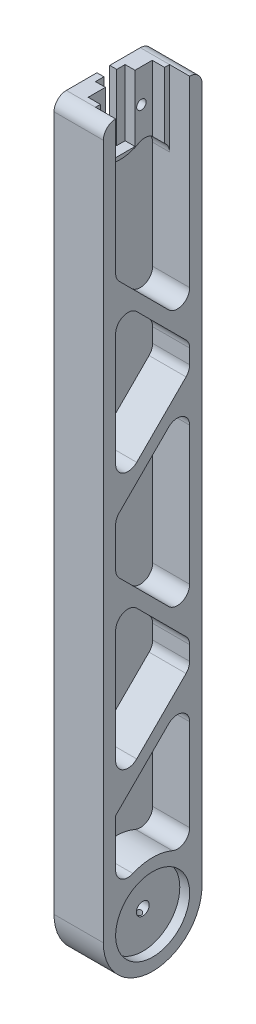
from build123d import *

# Parameters (mm, degrees)
SKETCH1_R                 = 12.7
BOSS_EXTRUDE1_DEPTH       = 12.7
BOSS_EXTRUDE2_DEPTH       = 17
CUT_EXTRUDE3_DEPTH        = 17
BOSS_EXTRUDE4_REACH       = 36.708
F_2_CLEARANCE_HOLE1_D     = 2.4384
F_2_CLEARANCE_HOLE1_DEPTH = 25.4
F_2_CLEARANCE_HOLE1_TIP   = 0.732569267
SKETCH14_W                = 52.115370156
SKETCH14_H                = 48.846284602
CUT_EXTRUDE4_DEPTH        = 12.7
SKETCH15_W                = 12.7
SKETCH15_H                = 25.4
BOSS_EXTRUDE5_DEPTH       = 177.8
SKETCH16_W                = 12.7
SKETCH16_H                = 3.175
BOSS_EXTRUDE6_DEPTH       = 17
FILLET1_R                 = 3.175
FILLET2_R                 = 12.7
SKETCH17_R                = 1.651
CUT_EXTRUDE5_DEPTH        = 9.525
SKETCH18_R                = 9.525
CUT_EXTRUDE6_DEPTH        = 2.54
CUT_EXTRUDE7_START        = -9.525
CUT_EXTRUDE7_DEPTH        = 9.525
SKETCH23_W                = 12.972727012
SKETCH23_H                = 10.013690803
CUT_EXTRUDE8_DEPTH        = 8.362229451
FILLET3_R                 = 3.175


# Read off the part's stored shape, not the designer's step: Cut-Extrude7
# Some blends are built 0.0001 mm under size
with BuildPart() as part:
    # Sketch1 → Boss-Extrude1 (new body)
    with BuildSketch(Plane(origin=(0, 0, 0), x_dir=(1, 0, 0), z_dir=(0, 1, 0))):
        with Locations(Location((0, 0, 0), (0, 0, 270))):
            Circle(SKETCH1_R)
    extrude(amount=BOSS_EXTRUDE1_DEPTH)

    # Sketch7 → Boss-Extrude2 (add)
    with BuildSketch(Plane(origin=(0, 12.7, 0), x_dir=(1, 0, 0), z_dir=(0, 1, 0))):
        with BuildLine():
            ThreePointArc((-8.400260413, 9.525), (-11.575260413, 5.225260413), (-12.7, 0))
            ThreePointArc((-12.7, 0), (-11.575260413, -5.225260413), (-8.400260413, -9.525))
            Line((-8.400260413, -9.525), (-5.08, -9.525))
            Line((-5.08, -9.525), (-5.08, -8.255))
            Line((-5.08, -8.255), (-8.254457173, -8.255))
            Line((-8.254457173, -8.255), (-8.254457173, 8.255))
            Line((-8.254457173, 8.255), (-5.08, 8.255))
            Line((-5.08, 8.255), (-5.08, 9.525))
            Line((-5.08, 9.525), (-8.400260413, 9.525))
        make_face()
    extrude(amount=BOSS_EXTRUDE2_DEPTH)

    # Sketch8 → Cut-Extrude3 (cut)
    with BuildSketch(Plane(origin=(0, 29.7, 0), x_dir=(1, 0, 0), z_dir=(0, 1, 0))):
        Polygon((-8.254457173, -3.81), (-8.254457173, 3.81), (-10.794457173, 3.81), (-10.794457173, 1.651), (-12.7, 1.651), (-12.7, -1.651), (-10.794457173, -1.651), (-10.794457173, -3.81), align=None)
    extrude(amount=-CUT_EXTRUDE3_DEPTH, mode=Mode.SUBTRACT)

    # Boss-Extrude4: up to this face of the body (flat: up to its plane)
    boss_extrude4_end = Plane(part.part.faces().sort_by_distance((0, 0, 0))[0])
    # Sketch13 → Boss-Extrude4 (add, up to the picked face)
    with BuildSketch(Plane(origin=(0, 29.7, 0), x_dir=(1, 0, 0), z_dir=(0, 1, 0)), mode=Mode.PRIVATE) as boss_extrude4_sk1:
        with BuildLine():
            Line((-12.592227722, 1.651), (-12.592227722, 9.525))
            Line((-12.592227722, 9.525), (-8.400260413, 9.525))
            ThreePointArc((-8.400260413, 9.525), (-11.210312597, 5.968156456), (-12.592227722, 1.651))
        make_face()
    boss_extrude4_tool1 = split(extrude(boss_extrude4_sk1.sketch, amount=-BOSS_EXTRUDE4_REACH, mode=Mode.PRIVATE), bisect_by=boss_extrude4_end, keep=Keep.BOTH, mode=Mode.PRIVATE)
    # Sketch13 → Boss-Extrude4 (add, up to the picked face)
    with BuildSketch(Plane(origin=(0, 29.7, 0), x_dir=(1, 0, 0), z_dir=(0, 1, 0)), mode=Mode.PRIVATE) as boss_extrude4_sk2:
        with BuildLine():
            Line((-12.592227722, -1.651), (-12.592227722, -9.525))
            Line((-12.592227722, -9.525), (-8.400260413, -9.525))
            ThreePointArc((-8.400260413, -9.525), (-11.210312597, -5.968156456), (-12.592227722, -1.651))
        make_face()
    boss_extrude4_tool2 = split(extrude(boss_extrude4_sk2.sketch, amount=-BOSS_EXTRUDE4_REACH, mode=Mode.PRIVATE), bisect_by=boss_extrude4_end, keep=Keep.BOTH, mode=Mode.PRIVATE)
    add(boss_extrude4_tool1.solids().sort_by(Axis((-11.366083, 29.7, -7.381946), (0, -1, 0)))[0])
    add(boss_extrude4_tool2.solids().sort_by(Axis((-11.366083, 29.7, 7.381946), (0, -1, 0)))[0])

    # #2 Clearance Hole1
    with Locations(Plane(origin=(-8.254457173, 0, 0), x_dir=(0, 0, -1), z_dir=(1, 0, 0))):
        with Locations((-5.46, 21.2), (5.46, 21.2)):
            Hole(F_2_CLEARANCE_HOLE1_D / 2, depth=F_2_CLEARANCE_HOLE1_DEPTH)
            with Locations((0, 0, -(F_2_CLEARANCE_HOLE1_DEPTH + F_2_CLEARANCE_HOLE1_TIP / 2))):  # 118° drill point
                Cone(0, F_2_CLEARANCE_HOLE1_D / 2, F_2_CLEARANCE_HOLE1_TIP, mode=Mode.SUBTRACT)

    # Sketch14 → Cut-Extrude4 (cut)
    with BuildSketch(Plane(origin=(0, 12.7, 0), x_dir=(1, 0, 0), z_dir=(0, 1, 0))):
        Rectangle(SKETCH14_W, SKETCH14_H)
    extrude(amount=-CUT_EXTRUDE4_DEPTH, mode=Mode.SUBTRACT)


with BuildPart() as cut_extrude4_piece_1:
    # of the separate pieces the step leaves, piece 1, a body of its own (cut_extrude4_pieces)
    add(part.part.solids().sort_by_distance((-5.08, 29.7, 9.525))[0])



with BuildPart() as cut_extrude4_piece_2:
    # of the separate pieces the step leaves, piece 2, a body of its own (cut_extrude4_pieces)
    add(part.part.solids().sort_by_distance((-12.592227722, 29.7, -9.525))[0])


with BuildPart() as cut_extrude4_piece_1_1:
    add(cut_extrude4_piece_1.part)

    add(cut_extrude4_piece_2.part)  # Boss-Extrude5 merges Cut-Extrude4 piece 2
    # Sketch15 → Boss-Extrude5 (add)
    with BuildSketch(Plane.XZ.offset(-12.7)):
        with Locations((-6.242227722, 0)):
            Rectangle(SKETCH15_W, SKETCH15_H)
    extrude(amount=BOSS_EXTRUDE5_DEPTH)

    # Sketch16 → Boss-Extrude6 (add)
    with BuildSketch(Plane(origin=(0, 12.7, 0), x_dir=(1, 0, 0), z_dir=(0, 1, 0))):
        with Locations((-6.242227722, 11.1125)):
            Rectangle(SKETCH16_W, SKETCH16_H)
        with Locations((-6.242227722, -11.1125)):
            Rectangle(SKETCH16_W, SKETCH16_H)
    extrude(amount=BOSS_EXTRUDE6_DEPTH)

    # Fillet1
    fillet1_edges = [cut_extrude4_piece_1_1.edges().sort_by_distance(p)[0] for p in [
        (-6.242227722, 29.7, 12.7),
        (-6.242227722, 29.7, -12.7),
    ]]
    fillet(fillet1_edges, radius=FILLET1_R - 0.0001)  # a hair under: the kernel refuses the full size

    # Fillet2
    fillet2_edges = [cut_extrude4_piece_1_1.edges().sort_by_distance(p)[0] for p in [
        (-6.242227722, -165.1, 12.7),
        (-6.242227722, -165.1, -12.7),
    ]]
    fillet(fillet2_edges, radius=FILLET2_R - 0.0001)  # a hair under: the kernel refuses the full size

    # Sketch17 → Cut-Extrude5 (cut)
    with BuildSketch(Plane(origin=(0.107772278, 0, 0), x_dir=(0, 0, -1), z_dir=(1, 0, 0))):
        with Locations((0, -152.4)):
            Circle(SKETCH17_R)
    extrude(amount=-CUT_EXTRUDE5_DEPTH, mode=Mode.SUBTRACT)

    # Sketch18 → Cut-Extrude6 (cut)
    with BuildSketch(Plane(origin=(0.107772278, 0, 0), x_dir=(0, 0, -1), z_dir=(1, 0, 0))):
        with Locations((0, -152.4)):
            Circle(SKETCH18_R)
    extrude(amount=-CUT_EXTRUDE6_DEPTH, mode=Mode.SUBTRACT)

    # Sketch19 → #2-56 Tapped Hole1 (revolve, cut)
    with BuildSketch(Plane(origin=(-3.702227722, -152.4, 0), x_dir=(0, 0, 1), z_dir=(1, 0, 0))):
        Polygon((0, 0), (0, 13.74216509), (0.889, 13.208), (0.889, 0), align=None)
    revolve(axis=Axis((-3.702227722, -146.05, 0), (0, -1, 0)), mode=Mode.SUBTRACT)

    # Cut-Extrude7 outline → Cut-Extrude7 (cut)
    with BuildSketch(Plane(origin=(0.107772278, 0, 0), x_dir=(0, 0, -1), z_dir=(1, 0, 0)).offset(CUT_EXTRUDE7_START)):
        with BuildLine():
            Line((-9.525, -6.059343702), (9.525, -25.109343702))
            Line((9.525, -25.109343702), (9.525, 21.2))
            ThreePointArc((9.525, 21.2), (0, 11.675), (-9.525, 21.2))
            Line((-9.525, 21.2), (-9.525, -6.059343702))
        make_face()
        Polygon((-9.525, -54.999471762), (9.525, -35.949471762), (9.525, -29.599471762), (-9.525, -10.549471762), align=None)
        Polygon((-9.525, -72.189599823), (9.525, -91.239599823), (9.525, -40.439599823), (-9.525, -59.489599823), align=None)
        Polygon((-9.525, -121.129727883), (9.525, -102.079727883), (9.525, -95.729727883), (-9.525, -76.679727883), align=None)
        with BuildLine():
            ThreePointArc((-9.525, -143.999739587), (0, -139.7), (9.525, -143.999739587))
            Line((9.525, -143.999739587), (9.525, -106.569855944))
            Line((9.525, -106.569855944), (-9.525, -125.619855944))
            Line((-9.525, -125.619855944), (-9.525, -143.999739587))
        make_face()
    extrude(amount=CUT_EXTRUDE7_DEPTH, mode=Mode.SUBTRACT)

    # Sketch23 → Cut-Extrude8 (cut)
    with BuildSketch(Plane(origin=(-8.254457173, 0, 0), x_dir=(0, 0, -1), z_dir=(1, 0, 0))):
        with Locations((0.296508778, 11.530489285)):
            Rectangle(SKETCH23_W, SKETCH23_H)
    extrude(amount=CUT_EXTRUDE8_DEPTH, mode=Mode.SUBTRACT)

    # Fillet3
    # the kernel refuses this fillet: 3.175 mm, written as the material it adds along each edge
    with BuildSketch(Plane(origin=(-12.705047873, -6.059343702, 9.525), x_dir=(0, -0.7071067811865476, -0.7071067811865476), z_dir=(1, 0, 0))) as fillet3_piece_1_section:
        with BuildLine():
            CenterArc((FILLET3_R * 0.414213562373, FILLET3_R), FILLET3_R, 225, 45)
            Line((-FILLET3_R * 0.292893218813, FILLET3_R * 0.292893218813), (0, 0))
            Line((0, 0), (FILLET3_R * 0.414213562373, 0))
        make_face()
    fillet3_piece_1 = extrude(amount=12.812820151, mode=Mode.PRIVATE)
    fillet3_piece_1 = split(fillet3_piece_1, bisect_by=Plane(origin=(-12.592227722, -5.980218736, 9.333975434), z_dir=(1, 0, 0)), keep=Keep.TOP, mode=Mode.PRIVATE)
    add(fillet3_piece_1)
    with BuildSketch(Plane(origin=(-28.580047873, -25.109343702, -9.525), x_dir=(0, 1, 0), z_dir=(1, 0, 0))) as fillet3_piece_2_section:
        with BuildLine():
            CenterArc((FILLET3_R * 2.41421356237, FILLET3_R), FILLET3_R, 135, 135)
            Line((FILLET3_R * 1.70710678119, FILLET3_R * 1.70710678119), (0, 0))
            Line((0, 0), (FILLET3_R * 2.41421356237, 0))
        make_face()
    fillet3_piece_2 = extrude(amount=28.687820151, mode=Mode.PRIVATE)
    fillet3_piece_2 = split(fillet3_piece_2, bisect_by=Plane(origin=(-12.592227722, -21.703583978, -8.114288132), z_dir=(1, 0, 0)), keep=Keep.TOP, mode=Mode.PRIVATE)
    add(fillet3_piece_2)
    with BuildSketch(Plane(origin=(-36.913534292, 21.2, -9.525), x_dir=(0, -0.8660254037844385, 0.5000000000000003), z_dir=(1, 0, 0))) as fillet3_piece_3_section:
        with BuildLine():
            CenterArc((11.1125, 2.749630657), FILLET3_R, 120, 120)
            Line((9.525, 5.499261314), (0, 0))
            ThreePointArc((0, 0), (4.7625, 1.276108029), (9.525, 0))
        make_face()
    fillet3_piece_3 = extrude(amount=59.329840862, mode=Mode.PRIVATE)
    fillet3_piece_3 = split(fillet3_piece_3, bisect_by=Plane(origin=(-8.254457173, 14.198741561, -7.389428404), z_dir=(-1, 0, 0)), keep=Keep.TOP, mode=Mode.PRIVATE)
    fillet3_piece_3 = split(fillet3_piece_3, bisect_by=Plane(origin=(-12.592227722, 14.198741561, -7.389428404), z_dir=(1, 0, 0)), keep=Keep.TOP, mode=Mode.PRIVATE)
    add(fillet3_piece_3)
    with BuildSketch(Plane(origin=(-36.913534292, 21.2, -9.525), x_dir=(0, -0.8660254037844385, 0.5000000000000003), z_dir=(1, 0, 0))) as fillet3_piece_4_section:
        with BuildLine():
            CenterArc((11.1125, 2.749630657), FILLET3_R, 120, 120)
            Line((9.525, 5.499261314), (0, 0))
            ThreePointArc((0, 0), (4.7625, 1.276108029), (9.525, 0))
        make_face()
    fillet3_piece_4 = extrude(amount=31.833534292, mode=Mode.PRIVATE)
    fillet3_piece_4 = split(fillet3_piece_4, bisect_by=Plane(origin=(-6.667228586, 15.056349516, -8.255), z_dir=(0, 0, -1)), keep=Keep.TOP, mode=Mode.PRIVATE)
    fillet3_piece_4 = split(fillet3_piece_4, bisect_by=Plane(origin=(-12.592227722, 15.056349516, -8.990866495), z_dir=(1, 0, 0)), keep=Keep.TOP, mode=Mode.PRIVATE)
    add(fillet3_piece_4)
    with BuildSketch(Plane(origin=(-36.913534292, 21.2, 9.525), x_dir=(0, -0.8660254037844385, -0.5000000000000003), z_dir=(1, 0, 0))) as fillet3_piece_5_section:
        with BuildLine():
            CenterArc((11.1125, -2.749630657), FILLET3_R, 120, 120)
            Line((9.525, -5.499261314), (0, 0))
            ThreePointArc((0, 0), (4.7625, -1.276108029), (9.525, 0))
        make_face()
    fillet3_piece_5 = extrude(amount=59.329840862, mode=Mode.PRIVATE)
    fillet3_piece_5 = split(fillet3_piece_5, bisect_by=Plane(origin=(-8.254457173, 14.198741561, 7.389428404), z_dir=(-1, 0, 0)), keep=Keep.TOP, mode=Mode.PRIVATE)
    fillet3_piece_5 = split(fillet3_piece_5, bisect_by=Plane(origin=(-12.592227722, 14.198741561, 7.389428404), z_dir=(1, 0, 0)), keep=Keep.TOP, mode=Mode.PRIVATE)
    add(fillet3_piece_5)
    with BuildSketch(Plane(origin=(-36.913534292, 21.2, 9.525), x_dir=(0, -0.8660254037844385, -0.5000000000000003), z_dir=(1, 0, 0))) as fillet3_piece_6_section:
        with BuildLine():
            CenterArc((11.1125, -2.749630657), FILLET3_R, 120, 120)
            Line((9.525, -5.499261314), (0, 0))
            ThreePointArc((0, 0), (4.7625, -1.276108029), (9.525, 0))
        make_face()
    fillet3_piece_6 = extrude(amount=31.833534292, mode=Mode.PRIVATE)
    fillet3_piece_6 = split(fillet3_piece_6, bisect_by=Plane(origin=(-6.667228586, 15.056349516, 8.255), z_dir=(0, 0, 1)), keep=Keep.TOP, mode=Mode.PRIVATE)
    fillet3_piece_6 = split(fillet3_piece_6, bisect_by=Plane(origin=(-12.592227722, 15.056349516, 8.990866495), z_dir=(1, 0, 0)), keep=Keep.TOP, mode=Mode.PRIVATE)
    add(fillet3_piece_6)
    with BuildSketch(Plane(origin=(-28.580047873, -10.549471762, 9.525), x_dir=(0, -0.7071067811865476, -0.7071067811865475), z_dir=(1, 0, 0))) as fillet3_piece_7_section:
        with BuildLine():
            CenterArc((FILLET3_R * 2.41421356237, -FILLET3_R), FILLET3_R, 90, 135)
            Line((FILLET3_R * 1.70710678119, -FILLET3_R * 1.70710678119), (0, 0))
            Line((0, 0), (FILLET3_R * 2.41421356237, 0))
        make_face()
    fillet3_piece_7 = extrude(amount=28.687820151, mode=Mode.PRIVATE)
    fillet3_piece_7 = split(fillet3_piece_7, bisect_by=Plane(origin=(-12.592227722, -13.955231486, 8.114288132), z_dir=(1, 0, 0)), keep=Keep.TOP, mode=Mode.PRIVATE)
    add(fillet3_piece_7)
    with BuildSketch(Plane(origin=(-28.580047873, -54.999471762, 9.525), x_dir=(0, 0.7071067811865476, -0.7071067811865475), z_dir=(1, 0, 0))) as fillet3_piece_8_section:
        with BuildLine():
            CenterArc((FILLET3_R * 2.41421356237, FILLET3_R), FILLET3_R, 135, 135)
            Line((FILLET3_R * 1.70710678119, FILLET3_R * 1.70710678119), (0, 0))
            Line((0, 0), (FILLET3_R * 2.41421356237, 0))
        make_face()
    fillet3_piece_8 = extrude(amount=28.687820151, mode=Mode.PRIVATE)
    fillet3_piece_8 = split(fillet3_piece_8, bisect_by=Plane(origin=(-12.592227722, -51.593712038, 8.114288132), z_dir=(1, 0, 0)), keep=Keep.TOP, mode=Mode.PRIVATE)
    add(fillet3_piece_8)
    with BuildSketch(Plane(origin=(-12.705047873, -35.949471762, -9.525), x_dir=(0, 1, 0), z_dir=(1, 0, 0))) as fillet3_piece_9_section:
        with BuildLine():
            CenterArc((FILLET3_R * 0.414213562373, FILLET3_R), FILLET3_R, 225, 45)
            Line((-FILLET3_R * 0.292893218813, FILLET3_R * 0.292893218813), (0, 0))
            Line((0, 0), (FILLET3_R * 0.414213562373, 0))
        make_face()
    fillet3_piece_9 = extrude(amount=12.812820151, mode=Mode.PRIVATE)
    fillet3_piece_9 = split(fillet3_piece_9, bisect_by=Plane(origin=(-12.592227722, -35.870346796, -9.333975434), z_dir=(1, 0, 0)), keep=Keep.TOP, mode=Mode.PRIVATE)
    add(fillet3_piece_9)
    with BuildSketch(Plane(origin=(-12.705047873, -29.599471762, -9.525), x_dir=(0, 0.7071067811865481, 0.7071067811865468), z_dir=(1, 0, 0))) as fillet3_piece_10_section:
        with BuildLine():
            CenterArc((FILLET3_R * 0.414213562373, FILLET3_R), FILLET3_R, 225, 45)
            Line((-FILLET3_R * 0.292893218813, FILLET3_R * 0.292893218813), (0, 0))
            Line((0, 0), (FILLET3_R * 0.414213562373, 0))
        make_face()
    fillet3_piece_10 = extrude(amount=12.812820151, mode=Mode.PRIVATE)
    fillet3_piece_10 = split(fillet3_piece_10, bisect_by=Plane(origin=(-12.592227722, -29.678596728, -9.333975434), z_dir=(1, 0, 0)), keep=Keep.TOP, mode=Mode.PRIVATE)
    add(fillet3_piece_10)
    with BuildSketch(Plane(origin=(-12.705047873, -72.189599823, 9.525), x_dir=(0, -0.7071067811865476, -0.7071067811865476), z_dir=(1, 0, 0))) as fillet3_piece_11_section:
        with BuildLine():
            CenterArc((FILLET3_R * 0.414213562373, FILLET3_R), FILLET3_R, 225, 45)
            Line((-FILLET3_R * 0.292893218813, FILLET3_R * 0.292893218813), (0, 0))
            Line((0, 0), (FILLET3_R * 0.414213562373, 0))
        make_face()
    fillet3_piece_11 = extrude(amount=12.812820151, mode=Mode.PRIVATE)
    fillet3_piece_11 = split(fillet3_piece_11, bisect_by=Plane(origin=(-12.592227722, -72.110474857, 9.333975434), z_dir=(1, 0, 0)), keep=Keep.TOP, mode=Mode.PRIVATE)
    add(fillet3_piece_11)
    with BuildSketch(Plane(origin=(-28.580047873, -91.239599823, -9.525), x_dir=(0, 1, 0), z_dir=(1, 0, 0))) as fillet3_piece_12_section:
        with BuildLine():
            CenterArc((FILLET3_R * 2.41421356237, FILLET3_R), FILLET3_R, 135, 135)
            Line((FILLET3_R * 1.70710678119, FILLET3_R * 1.70710678119), (0, 0))
            Line((0, 0), (FILLET3_R * 2.41421356237, 0))
        make_face()
    fillet3_piece_12 = extrude(amount=28.687820151, mode=Mode.PRIVATE)
    fillet3_piece_12 = split(fillet3_piece_12, bisect_by=Plane(origin=(-12.592227722, -87.833840099, -8.114288132), z_dir=(1, 0, 0)), keep=Keep.TOP, mode=Mode.PRIVATE)
    add(fillet3_piece_12)
    with BuildSketch(Plane(origin=(-28.580047873, -40.439599823, -9.525), x_dir=(0, -0.7071067811865476, 0.7071067811865475), z_dir=(1, 0, 0))) as fillet3_piece_13_section:
        with BuildLine():
            CenterArc((FILLET3_R * 2.41421356237, FILLET3_R), FILLET3_R, 135, 135)
            Line((FILLET3_R * 1.70710678119, FILLET3_R * 1.70710678119), (0, 0))
            Line((0, 0), (FILLET3_R * 2.41421356237, 0))
        make_face()
    fillet3_piece_13 = extrude(amount=28.687820151, mode=Mode.PRIVATE)
    fillet3_piece_13 = split(fillet3_piece_13, bisect_by=Plane(origin=(-12.592227722, -43.845359547, -8.114288132), z_dir=(1, 0, 0)), keep=Keep.TOP, mode=Mode.PRIVATE)
    add(fillet3_piece_13)
    with BuildSketch(Plane(origin=(-12.705047873, -59.489599823, 9.525), x_dir=(0, 0.7071067811865468, -0.7071067811865481), z_dir=(1, 0, 0))) as fillet3_piece_14_section:
        with BuildLine():
            CenterArc((FILLET3_R * 0.414213562373, -FILLET3_R), FILLET3_R, 90, 45)
            Line((-FILLET3_R * 0.292893218813, -FILLET3_R * 0.292893218813), (0, 0))
            Line((0, 0), (FILLET3_R * 0.414213562373, 0))
        make_face()
    fillet3_piece_14 = extrude(amount=12.812820151, mode=Mode.PRIVATE)
    fillet3_piece_14 = split(fillet3_piece_14, bisect_by=Plane(origin=(-12.592227722, -59.568724789, 9.333975434), z_dir=(1, 0, 0)), keep=Keep.TOP, mode=Mode.PRIVATE)
    add(fillet3_piece_14)
    with BuildSketch(Plane(origin=(-28.580047873, -76.679727883, 9.525), x_dir=(0, -0.7071067811865475, -0.7071067811865476), z_dir=(1, 0, 0))) as fillet3_piece_15_section:
        with BuildLine():
            CenterArc((FILLET3_R * 2.41421356237, -FILLET3_R), FILLET3_R, 90, 135)
            Line((FILLET3_R * 1.70710678119, -FILLET3_R * 1.70710678119), (0, 0))
            Line((0, 0), (FILLET3_R * 2.41421356237, 0))
        make_face()
    fillet3_piece_15 = extrude(amount=28.687820151, mode=Mode.PRIVATE)
    fillet3_piece_15 = split(fillet3_piece_15, bisect_by=Plane(origin=(-12.592227722, -80.085487607, 8.114288132), z_dir=(1, 0, 0)), keep=Keep.TOP, mode=Mode.PRIVATE)
    add(fillet3_piece_15)
    with BuildSketch(Plane(origin=(-28.580047873, -121.129727883, 9.525), x_dir=(0, 0.7071067811865472, -0.7071067811865479), z_dir=(1, 0, 0))) as fillet3_piece_16_section:
        with BuildLine():
            CenterArc((FILLET3_R * 2.41421356237, FILLET3_R), FILLET3_R, 135, 135)
            Line((FILLET3_R * 1.70710678119, FILLET3_R * 1.70710678119), (0, 0))
            Line((0, 0), (FILLET3_R * 2.41421356237, 0))
        make_face()
    fillet3_piece_16 = extrude(amount=28.687820151, mode=Mode.PRIVATE)
    fillet3_piece_16 = split(fillet3_piece_16, bisect_by=Plane(origin=(-12.592227722, -117.723968159, 8.114288132), z_dir=(1, 0, 0)), keep=Keep.TOP, mode=Mode.PRIVATE)
    add(fillet3_piece_16)
    with BuildSketch(Plane(origin=(-12.705047873, -102.079727883, -9.525), x_dir=(0, 1, 0), z_dir=(1, 0, 0))) as fillet3_piece_17_section:
        with BuildLine():
            CenterArc((FILLET3_R * 0.414213562373, FILLET3_R), FILLET3_R, 225, 45)
            Line((-FILLET3_R * 0.292893218813, FILLET3_R * 0.292893218813), (0, 0))
            Line((0, 0), (FILLET3_R * 0.414213562373, 0))
        make_face()
    fillet3_piece_17 = extrude(amount=12.812820151, mode=Mode.PRIVATE)
    fillet3_piece_17 = split(fillet3_piece_17, bisect_by=Plane(origin=(-12.592227722, -102.000602917, -9.333975434), z_dir=(1, 0, 0)), keep=Keep.TOP, mode=Mode.PRIVATE)
    add(fillet3_piece_17)
    with BuildSketch(Plane(origin=(-12.705047873, -95.729727883, -9.525), x_dir=(0, 0.7071067811865455, 0.7071067811865495), z_dir=(1, 0, 0))) as fillet3_piece_18_section:
        with BuildLine():
            CenterArc((FILLET3_R * 0.414213562373, FILLET3_R), FILLET3_R, 225, 45)
            Line((-FILLET3_R * 0.292893218813, FILLET3_R * 0.292893218813), (0, 0))
            Line((0, 0), (FILLET3_R * 0.414213562373, 0))
        make_face()
    fillet3_piece_18 = extrude(amount=12.812820151, mode=Mode.PRIVATE)
    fillet3_piece_18 = split(fillet3_piece_18, bisect_by=Plane(origin=(-12.592227722, -95.808852849, -9.333975434), z_dir=(1, 0, 0)), keep=Keep.TOP, mode=Mode.PRIVATE)
    add(fillet3_piece_18)
    with BuildSketch(Plane(origin=(-28.580047873, -106.569855944, -9.525), x_dir=(0, -0.7071067811865474, 0.7071067811865476), z_dir=(1, 0, 0))) as fillet3_piece_19_section:
        with BuildLine():
            CenterArc((FILLET3_R * 2.41421356237, FILLET3_R), FILLET3_R, 135, 135)
            Line((FILLET3_R * 1.70710678119, FILLET3_R * 1.70710678119), (0, 0))
            Line((0, 0), (FILLET3_R * 2.41421356237, 0))
        make_face()
    fillet3_piece_19 = extrude(amount=28.687820151, mode=Mode.PRIVATE)
    fillet3_piece_19 = split(fillet3_piece_19, bisect_by=Plane(origin=(-12.592227722, -109.975615668, -8.114288132), z_dir=(1, 0, 0)), keep=Keep.TOP, mode=Mode.PRIVATE)
    add(fillet3_piece_19)
    with BuildSketch(Plane(origin=(-24.790771268, -143.999739587, 9.525), x_dir=(0, 0.5889746247804543, -0.8081515274778135), z_dir=(1, 0, 0))) as fillet3_piece_20_section:
        with BuildLine():
            CenterArc((6.187731916, 3.099666646), FILLET3_R, 143.915721818, 113.578178477)
            Line((3.621850817, 4.96966108), (0, 0))
            ThreePointArc((0, 0), (2.750103074, 0.301333415), (5.500206148, 0))
        make_face()
    fillet3_piece_20 = extrude(amount=24.898543546, mode=Mode.PRIVATE)
    fillet3_piece_20 = split(fillet3_piece_20, bisect_by=Plane(origin=(-12.592227722, -141.454802798, 8.459851128), z_dir=(1, 0, 0)), keep=Keep.TOP, mode=Mode.PRIVATE)
    add(fillet3_piece_20)
    with BuildSketch(Plane(origin=(-24.790771268, -143.999739587, -9.525), x_dir=(0, 1, 0), z_dir=(1, 0, 0))) as fillet3_piece_21_section:
        with BuildLine():
            CenterArc((6.149417419, 3.175), FILLET3_R, 156.421821523, 113.578178477)
            ThreePointArc((3.239481852, 4.445), (1.863263986, 2.045022265), (0, 0))
            Line((0, 0), (6.149417419, 0))
        make_face()
    fillet3_piece_21 = extrude(amount=24.898543546, mode=Mode.PRIVATE)
    fillet3_piece_21 = split(fillet3_piece_21, bisect_by=Plane(origin=(-12.592227722, -141.454802798, -8.459851128), z_dir=(1, 0, 0)), keep=Keep.TOP, mode=Mode.PRIVATE)
    add(fillet3_piece_21)


solid = cut_extrude4_piece_1_1.part
